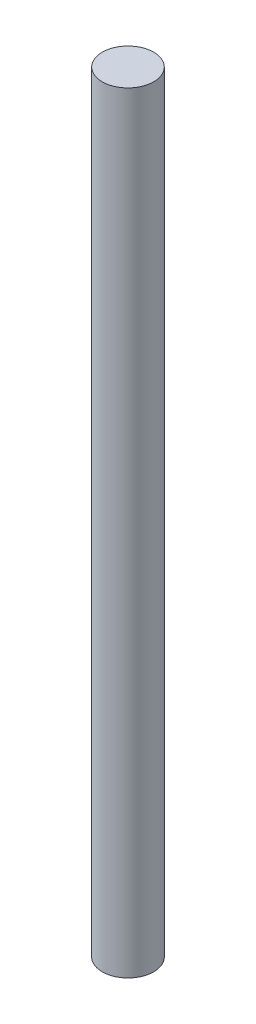
from build123d import *

# Parameters (mm, degrees)
SKETCH1_R    = 2
LENGTH_DEPTH = 60


with BuildPart() as part:
    # Sketch1 → Length (new body)
    with BuildSketch(Plane(origin=(0, 0, 0), x_dir=(1, 0, 0), z_dir=(0, 1, 0))):
        Circle(SKETCH1_R)
    extrude(amount=LENGTH_DEPTH)


solid = part.part
